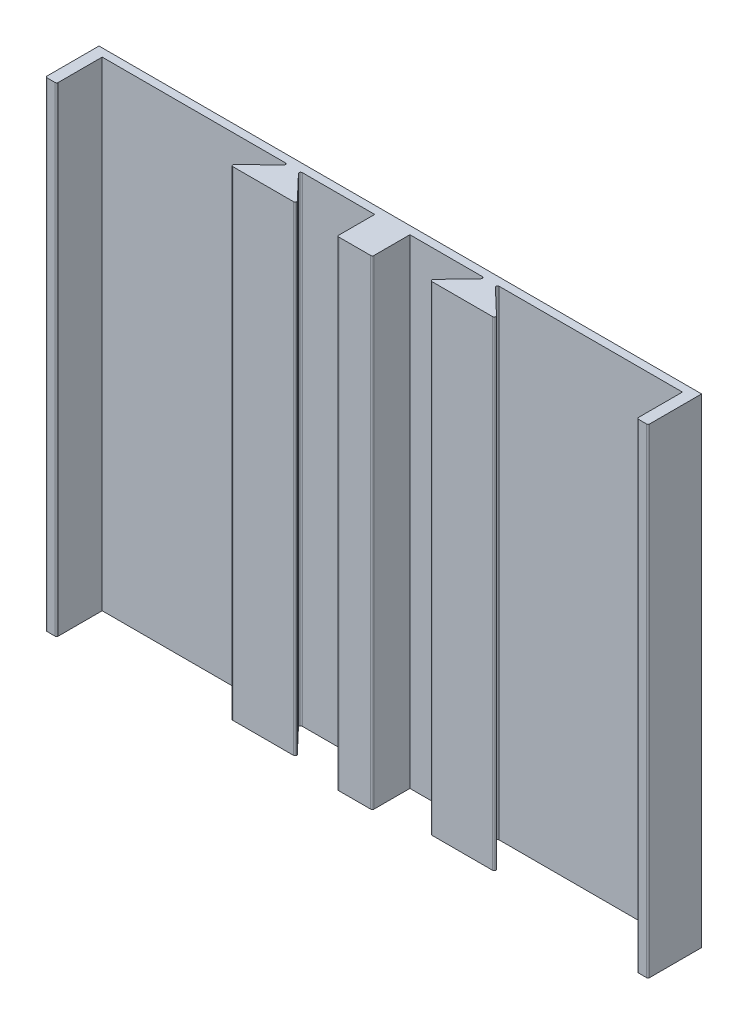
from build123d import *

# Parameters (mm, degrees)
BOSS_EXTRUDE1_DEPTH = 60
MOVE_FACE1_DEPTH    = 60
FILLET1_R           = 0.2


# Read off the part's stored shape, not the designer's step: Move Face1
with BuildPart() as part:
    # Sketch1 → Boss-Extrude1 (new body)
    with BuildSketch(Plane(origin=(0, 0, 0), x_dir=(1, 0, 0), z_dir=(0, 1, 0))):
        Polygon((7.721033882, 3.781430367), (3.536999802, -0.218569633), (13.536999802, -0.218569633), (9.721033882, 3.781430367), (18.536999802, 3.781430367), (18.536999802, -1.218569633), (23.536999802, -1.218569633), (23.536999802, 3.781430367), (32.352965722, 3.781430367), (28.536999802, -0.218569633), (38.536999802, -0.218569633), (34.352965722, 3.781430367), (57.036999802, 3.781430367), (57.036999802, -2.218569633), (59.036999802, -2.218569633), (59.036999802, 3.781430367), (59.036999802, 4.781430367), (-16.963000198, 4.781430367), (-16.963000198, 3.781430367), (-16.963000198, -2.218569633), (-14.963000198, -2.218569633), (-14.963000198, 3.781430367), align=None)
    extrude(amount=BOSS_EXTRUDE1_DEPTH)

    # Move Face1 outline → Move Face1 (cut)
    with BuildSketch(Plane(origin=(0, 0, 0), x_dir=(1, 0, 0), z_dir=(0, 1, 0))):
        Polygon((12.836183283, 0.081430367), (4.284936029, 0.081430367), (8.155167552, 3.781430367), (7.721033882, 3.781430367), (3.536999802, -0.218569633), (13.536999802, -0.218569633), (9.721033882, 3.781430367), (9.306414807, 3.781430367), align=None)
        Polygon((-14.963000198, -2.218569633), (-14.963000198, 3.781430367), (-15.263000198, 3.781430367), (-15.263000198, -1.918569633), (-16.663000198, -1.918569633), (-16.663000198, 4.781430367), (-16.963000198, 4.781430367), (-16.963000198, -2.218569633), align=None)
        Polygon((18.836999802, 3.781430367), (18.536999802, 3.781430367), (18.536999802, -1.218569633), (23.536999802, -1.218569633), (23.536999802, 3.781430367), (23.236999802, 3.781430367), (23.236999802, -0.918569633), (18.836999802, -0.918569633), align=None)
        Polygon((59.036999802, 4.781430367), (58.736999802, 4.781430367), (58.736999802, -1.918569633), (57.336999802, -1.918569633), (57.336999802, 3.781430367), (57.036999802, 3.781430367), (57.036999802, -2.218569633), (59.036999802, -2.218569633), align=None)
        Polygon((32.767584796, 3.781430367), (32.352965722, 3.781430367), (28.536999802, -0.218569633), (38.536999802, -0.218569633), (34.352965722, 3.781430367), (33.918832051, 3.781430367), (37.789063575, 0.081430367), (29.23781632, 0.081430367), align=None)
    extrude(amount=MOVE_FACE1_DEPTH, mode=Mode.SUBTRACT)

    # Fillet1
    fillet1_edges = [part.edges().sort_by_distance(p)[0] for p in [
        (-15.263000198, 30, 1.918569633),
        (-16.663000198, 30, 1.918569633),
        (58.736999802, 30, 1.918569633),
        (57.336999802, 30, 1.918569633),
        (33.918832051, 30, -3.781430367),
        (37.789063575, 30, -0.081430367),
        (29.23781632, 30, -0.081430367),
        (32.767584796, 30, -3.781430367),
        (23.236999802, 30, 0.918569633),
        (18.836999802, 30, 0.918569633),
        (9.306414807, 30, -3.781430367),
        (12.836183283, 30, -0.081430367),
        (4.284936029, 30, -0.081430367),
        (8.155167552, 30, -3.781430367),
    ]]
    fillet(fillet1_edges, radius=FILLET1_R)


solid = part.part
